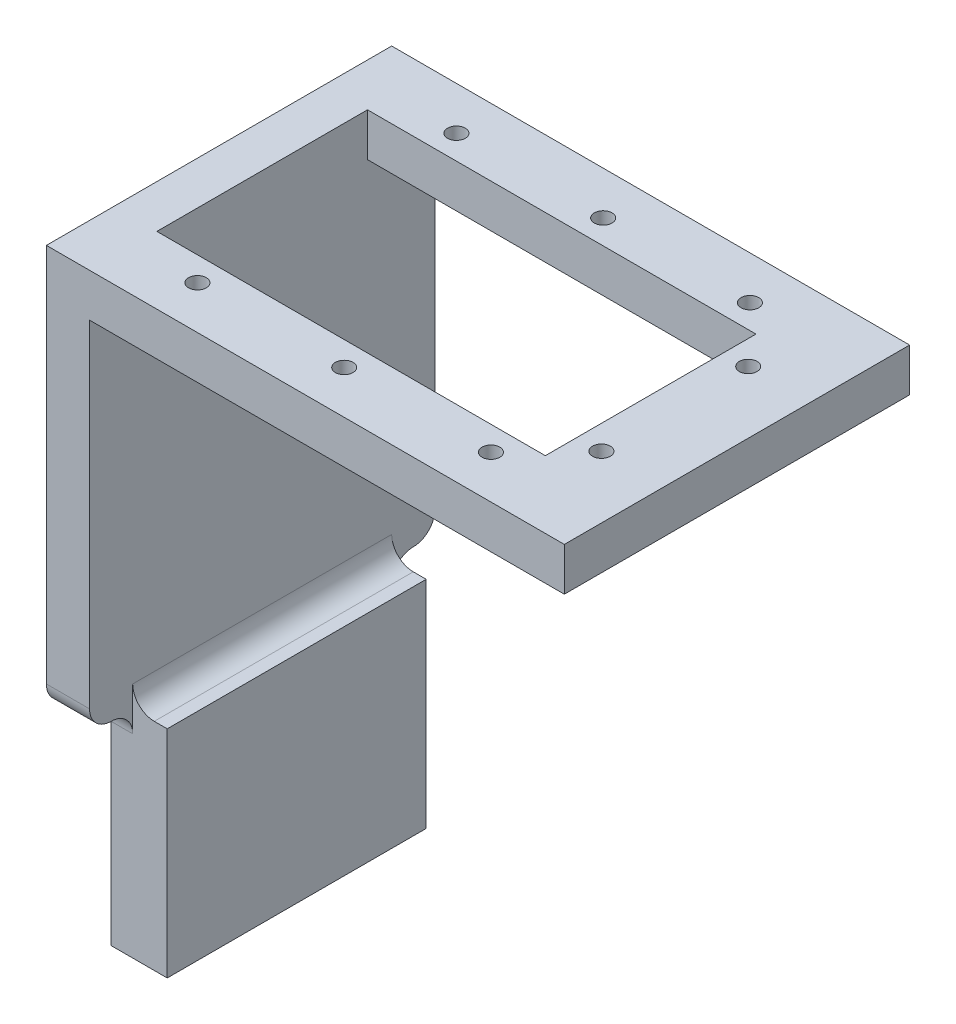
from build123d import *

# Parameters (mm, degrees)
SKETCH1_W           = 60
SKETCH1_H           = 40
SKETCH1_W_2         = 45
SKETCH1_H_2         = 24.4
BOSS_EXTRUDE1_DEPTH = 5
SKETCH6_W           = 5
SKETCH6_H           = 40
BOSS_EXTRUDE4_DEPTH = 41.5
SKETCH7_W           = 6.5
SKETCH7_H           = 30
BOSS_EXTRUDE5_DEPTH = 25
FILLET2_R           = 2.5
FILLET3_R           = 2.5
CUT_EXTRUDE1_REACH  = 100.093
SKETCH8_R           = 1.025


with BuildPart() as part:
    # Sketch1 → Boss-Extrude1 (new body)
    with BuildSketch(Plane(origin=(0, 0, 0), x_dir=(1, 0, 0), z_dir=(0, 1, 0))):
        with Locations((30, 20)):
            Rectangle(SKETCH1_W, SKETCH1_H)
        with Locations((27.5, 20)):
            Rectangle(SKETCH1_W_2, SKETCH1_H_2, mode=Mode.SUBTRACT)
    extrude(amount=BOSS_EXTRUDE1_DEPTH)

    # Sketch6 → Boss-Extrude4 (add)
    with BuildSketch(Plane.XZ):
        with Locations((2.5, -20)):
            Rectangle(SKETCH6_W, SKETCH6_H)
    extrude(amount=BOSS_EXTRUDE4_DEPTH)

    # Sketch7 → Boss-Extrude5 (add)
    with BuildSketch(Plane(origin=(0, -41.5, 0), x_dir=(-1, 0, 0), z_dir=(0, -1, 0))):
        with Locations((-5.75, 20)):
            Rectangle(SKETCH7_W, SKETCH7_H)
    extrude(amount=BOSS_EXTRUDE5_DEPTH)

    # Fillet2
    fillet2_edges = [part.edges().sort_by_distance(p)[0] for p in [
        (5, -41.5, -20),
        (2.5, -41.5, -20),
    ]]
    fillet(fillet2_edges, radius=FILLET2_R - 0.0001)  # a hair under: the kernel refuses the full size

    # Fillet3
    fillet3_edges = [part.edges().sort_by_distance(p)[0] for p in [
        (2.50005, -41.5, -5),
        (2.50005, -41.5, -35),
        (2.5, -41.5, 0),
        (2.5, -41.5, -40),
    ]]
    fillet(fillet3_edges, radius=FILLET3_R - 0.0001)  # a hair under: the kernel refuses the full size

    # Sketch8 → Cut-Extrude1 (cut, up to next)
    with BuildSketch(Plane(origin=(0, 0, 0), x_dir=(-1, 0, 0), z_dir=(0, -1, 0)), mode=Mode.PRIVATE) as cut_extrude1_sk1:
        with Locations(Location((-52.8, 28.5, 0), (0, 0, 90))):
            Circle(SKETCH8_R)
    cut_extrude1_tool1 = extrude(cut_extrude1_sk1.sketch, amount=-CUT_EXTRUDE1_REACH, mode=Mode.PRIVATE) & part.part
    # Sketch8 → Cut-Extrude1 (cut, up to next)
    with BuildSketch(Plane(origin=(0, 0, 0), x_dir=(-1, 0, 0), z_dir=(0, -1, 0)), mode=Mode.PRIVATE) as cut_extrude1_sk2:
        with Locations(Location((-46.5, 35, 0), (0, 0, 90))):
            Circle(SKETCH8_R)
    cut_extrude1_tool2 = extrude(cut_extrude1_sk2.sketch, amount=-CUT_EXTRUDE1_REACH, mode=Mode.PRIVATE) & part.part
    # Sketch8 → Cut-Extrude1 (cut, up to next)
    with BuildSketch(Plane(origin=(0, 0, 0), x_dir=(-1, 0, 0), z_dir=(0, -1, 0)), mode=Mode.PRIVATE) as cut_extrude1_sk3:
        with Locations(Location((-29.5, 35, 0), (0, 0, 90))):
            Circle(SKETCH8_R)
    cut_extrude1_tool3 = extrude(cut_extrude1_sk3.sketch, amount=-CUT_EXTRUDE1_REACH, mode=Mode.PRIVATE) & part.part
    # Sketch8 → Cut-Extrude1 (cut, up to next)
    with BuildSketch(Plane(origin=(0, 0, 0), x_dir=(-1, 0, 0), z_dir=(0, -1, 0)), mode=Mode.PRIVATE) as cut_extrude1_sk4:
        with Locations(Location((-12.5, 35, 0), (0, 0, 90))):
            Circle(SKETCH8_R)
    cut_extrude1_tool4 = extrude(cut_extrude1_sk4.sketch, amount=-CUT_EXTRUDE1_REACH, mode=Mode.PRIVATE) & part.part
    # Sketch8 → Cut-Extrude1 (cut, up to next)
    with BuildSketch(Plane(origin=(0, 0, 0), x_dir=(-1, 0, 0), z_dir=(0, -1, 0)), mode=Mode.PRIVATE) as cut_extrude1_sk5:
        with Locations(Location((-12.5, 5, 0), (0, 0, 90))):
            Circle(SKETCH8_R)
    cut_extrude1_tool5 = extrude(cut_extrude1_sk5.sketch, amount=-CUT_EXTRUDE1_REACH, mode=Mode.PRIVATE) & part.part
    # Sketch8 → Cut-Extrude1 (cut, up to next)
    with BuildSketch(Plane(origin=(0, 0, 0), x_dir=(-1, 0, 0), z_dir=(0, -1, 0)), mode=Mode.PRIVATE) as cut_extrude1_sk6:
        with Locations(Location((-29.5, 5, 0), (0, 0, 90))):
            Circle(SKETCH8_R)
    cut_extrude1_tool6 = extrude(cut_extrude1_sk6.sketch, amount=-CUT_EXTRUDE1_REACH, mode=Mode.PRIVATE) & part.part
    # Sketch8 → Cut-Extrude1 (cut, up to next)
    with BuildSketch(Plane(origin=(0, 0, 0), x_dir=(-1, 0, 0), z_dir=(0, -1, 0)), mode=Mode.PRIVATE) as cut_extrude1_sk7:
        with Locations(Location((-46.5, 5, 0), (0, 0, 90))):
            Circle(SKETCH8_R)
    cut_extrude1_tool7 = extrude(cut_extrude1_sk7.sketch, amount=-CUT_EXTRUDE1_REACH, mode=Mode.PRIVATE) & part.part
    # Sketch8 → Cut-Extrude1 (cut, up to next)
    with BuildSketch(Plane(origin=(0, 0, 0), x_dir=(-1, 0, 0), z_dir=(0, -1, 0)), mode=Mode.PRIVATE) as cut_extrude1_sk8:
        with Locations(Location((-52.8, 11.5, 0), (0, 0, 90))):
            Circle(SKETCH8_R)
    cut_extrude1_tool8 = extrude(cut_extrude1_sk8.sketch, amount=-CUT_EXTRUDE1_REACH, mode=Mode.PRIVATE) & part.part
    add(cut_extrude1_tool1.solids().sort_by_distance((52.8, 0, -28.5))[0], mode=Mode.SUBTRACT)
    add(cut_extrude1_tool2.solids().sort_by_distance((46.5, 0, -35))[0], mode=Mode.SUBTRACT)
    add(cut_extrude1_tool3.solids().sort_by_distance((29.5, 0, -35))[0], mode=Mode.SUBTRACT)
    add(cut_extrude1_tool4.solids().sort_by_distance((12.5, 0, -35))[0], mode=Mode.SUBTRACT)
    add(cut_extrude1_tool5.solids().sort_by_distance((12.5, 0, -5))[0], mode=Mode.SUBTRACT)
    add(cut_extrude1_tool6.solids().sort_by_distance((29.5, 0, -5))[0], mode=Mode.SUBTRACT)
    add(cut_extrude1_tool7.solids().sort_by_distance((46.5, 0, -5))[0], mode=Mode.SUBTRACT)
    add(cut_extrude1_tool8.solids().sort_by_distance((52.8, 0, -11.5))[0], mode=Mode.SUBTRACT)


solid = part.part
